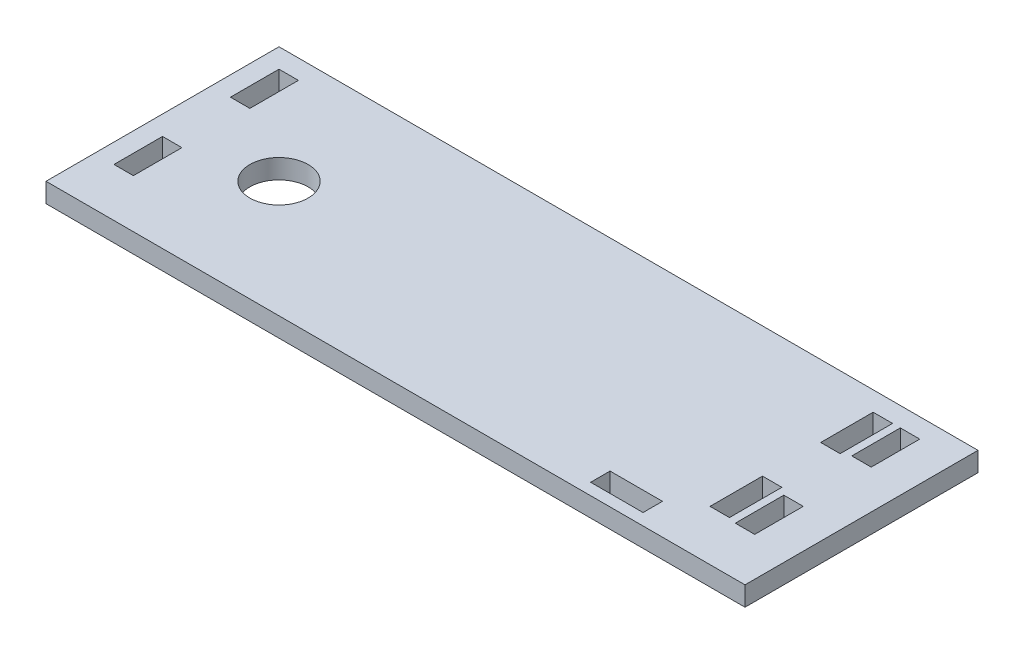
from build123d import *

# Parameters (mm, degrees)
SKETCH1_W           = 228.6
SKETCH1_H           = 76.2
SKETCH1_R           = 9.525
SKETCH1_W_2         = 6.35
SKETCH1_H_2         = 15.875
SKETCH1_H_3         = 17.145
SKETCH1_W_3         = 17.145
SKETCH1_H_4         = 6.35
BOSS_EXTRUDE1_DEPTH = 6.35


with BuildPart() as part:
    # Sketch1 → Boss-Extrude1 (new body)
    with BuildSketch(Plane(origin=(0, 0, 0), x_dir=(1, 0, 0), z_dir=(0, 1, 0))):
        Rectangle(SKETCH1_W, SKETCH1_H)
        with Locations((-76.2, 0)):
            Circle(SKETCH1_R, mode=Mode.SUBTRACT)
        with Locations((-104.775, -14.2875)):
            Rectangle(SKETCH1_W_2, SKETCH1_H_2, mode=Mode.SUBTRACT)
        with Locations((-104.775, 23.8125)):
            Rectangle(SKETCH1_W_2, SKETCH1_H_2, mode=Mode.SUBTRACT)
        with Locations((89.535, -13.0175)):
            Rectangle(SKETCH1_W_2, SKETCH1_H_3, mode=Mode.SUBTRACT)
        with Locations((98.425, 23.8125)):
            Rectangle(SKETCH1_W_2, SKETCH1_H_2, mode=Mode.SUBTRACT)
        with Locations((98.425, -14.2875)):
            Rectangle(SKETCH1_W_2, SKETCH1_H_2, mode=Mode.SUBTRACT)
        with Locations((89.535, 23.1775)):
            Rectangle(SKETCH1_W_2, SKETCH1_H_3, mode=Mode.SUBTRACT)
        with Locations((68.58, -31.115)):
            Rectangle(SKETCH1_W_3, SKETCH1_H_4, mode=Mode.SUBTRACT)
    extrude(amount=BOSS_EXTRUDE1_DEPTH)


solid = part.part
